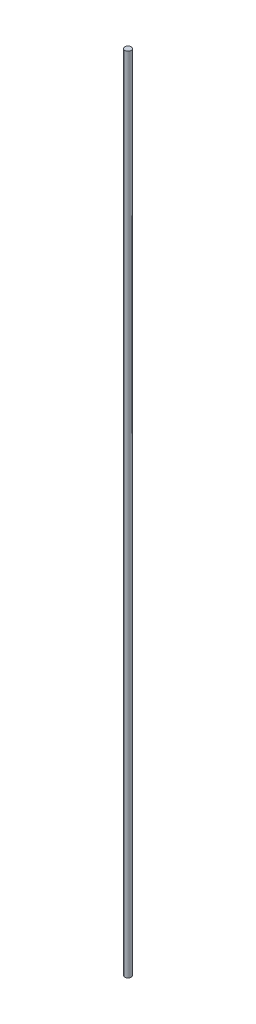
from build123d import *

# Parameters (mm, degrees)
SKETCH1_R           = 3.175
BOSS_EXTRUDE1_DEPTH = 406.4


with BuildPart() as part:
    # Sketch1 → Boss-Extrude1 (new, symmetric)
    with BuildSketch(Plane(origin=(0, 0, 0), x_dir=(1, 0, 0), z_dir=(0, 1, 0))):
        Circle(SKETCH1_R)
    extrude(amount=BOSS_EXTRUDE1_DEPTH, both=True)


solid = part.part
